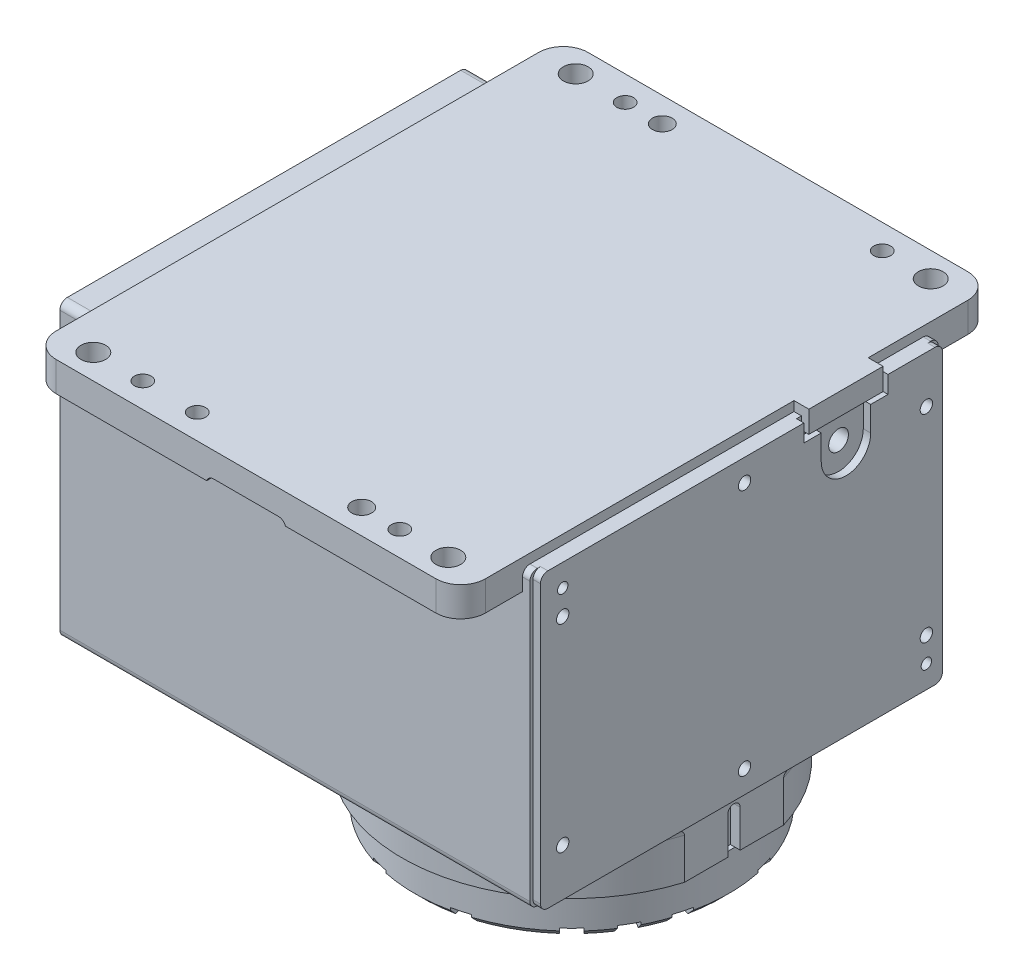
from build123d import *
from build123d.topology import SkipClean

# Parameters (mm, degrees)
SKETCH_1_W           = 186.99999787
SKETCH_1_H           = 165
EXTRUDE_1_DEPTH      = 118.00212
SKETCH_2_R           = 5
SKETCH_2_R_2         = 3.4
SKETCH_2_R_3         = 4
EXTRUDE_2_DEPTH      = 8.00224
CUT_EXTRUDE_1_DEPTH  = 25
CUT_EXTRUDE_START    = -25
CUT_EXTRUDE_2_DEPTH  = 25
EXTRUDE_START        = 3.99776
SKETCH_11_R          = 5
SKETCH_11_R_2        = 3.4
SKETCH_11_R_3        = 4
EXTRUDE_4_DEPTH      = 3.99776
FILLET_1_R           = 3
EXTRUDE_5_DEPTH      = 3
EXTRUDE_7_DEPTH      = 3
CUT_EXTRUDE_START_2  = -3
SKETCH_16_W          = 7.849893917
SKETCH_16_H          = 3.8429
SKETCH_16_W_2        = 32
CUT_EXTRUDE_3_DEPTH  = 3
CUT_EXTRUDE_4_DEPTH  = 3
FILLET_2_R           = 3
FILLET_3_R           = 3
FILLET_4_R           = 3
CUT_EXTRUDE_9_DEPTH  = 3
SKETCH_26_4_W        = 7
SKETCH_26_4_H        = 7
CUT_EXTRUDE_10_DEPTH = 6
SKETCH_27_W          = 20
SKETCH_27_H          = 5
CUT_EXTRUDE_11_DEPTH = 3
EXTRUDE_11_DEPTH     = 6
EXTRUDE_12_DEPTH     = 3
EXTRUDE_18_DEPTH     = 21.5
CUT_EXTRUDE_START_3  = -21.5
CUT_EXTRUDE_18_DEPTH = 21.5
FILLET_7_R           = 5
CUT_EXTRUDE_19_DEPTH = 4
SKETCH_37_R          = 63.5
EXTRUDE_19_DEPTH     = 18
CHAMFER_3_SIZE       = 3
CUT_EXTRUDE_20_DEPTH = 4
SKETCH_39_R          = 1.5
CUT_EXTRUDE_27_DEPTH = 6
SKETCH_30_R          = 4
CUT_EXTRUDE_29_DEPTH = 6
SKETCH_40_R          = 2.1
SKETCH_40_R_2        = 2.5
CUT_EXTRUDE_30_DEPTH = 8
SKETCH_41_R          = 2.5
CUT_EXTRUDE_31_DEPTH = 8
SKETCH_42_R          = 55
CUT_EXTRUDE_32_DEPTH = 10
FILLET_8_R           = 3


with BuildPart() as part:
    # ｽｹｯﾁ1 → ﾎﾞｽ - 押し出し1 (new body)
    with BuildSketch(Plane(origin=(0, 0, 0), x_dir=(1, 0, 0), z_dir=(0, 1, 0))):
        with Locations((93.499998935, 82.5)):
            Rectangle(SKETCH_1_W, SKETCH_1_H)
    extrude(amount=EXTRUDE_1_DEPTH)

    # ｽｹｯﾁ2 → ﾎﾞｽ - 押し出し2 (add)
    # profile 1 of 2: a face of its own
    with BuildSketch(Plane(origin=(0, 118.00212, 0), x_dir=(1, 0, 0), z_dir=(0, 1, 0))):
        with BuildLine():
            ThreePointArc((186.99999787, 180), (184.071065682, 187.071067812), (176.99999787, 190))
            Line((176.99999787, 190), (23.499999997, 190))
            ThreePointArc((23.499999997, 190), (16.428932185, 187.071067812), (13.499999997, 180))
            Line((13.499999997, 180), (13.499999997, 165))
            Line((13.499999997, 165), (186.99999787, 165))
            Line((186.99999787, 165), (186.99999787, 180))
        make_face()
        with Locations(Location((28.499999997, 180, 0), (0, 0, 270))):
            Circle(SKETCH_2_R, mode=Mode.SUBTRACT)
        with Locations(Location((48.499997861, 180, 0), (0, 0, 270))):
            Circle(SKETCH_2_R_2, mode=Mode.SUBTRACT)
        with Locations(Location((63.499999997, 180, 0), (0, 0, 270))):
            Circle(SKETCH_2_R_3, mode=Mode.SUBTRACT)
        with Locations(Location((152.402370037, 179.998516478, 0), (0, 0, 270))):
            Circle(SKETCH_2_R_2, mode=Mode.SUBTRACT)
        with Locations(Location((171.999995734, 180, 0), (0, 0, 270))):
            Circle(SKETCH_2_R, mode=Mode.SUBTRACT)
    # profile 2 of 2: a face of its own
    with BuildSketch(Plane(origin=(0, 118.00212, 0), x_dir=(1, 0, 0), z_dir=(0, 1, 0))):
        with BuildLine():
            ThreePointArc((13.499999997, -15), (16.428932185, -22.071067812), (23.499999997, -25))
            Line((23.499999997, -25), (176.99999787, -25))
            ThreePointArc((176.99999787, -25), (184.071065682, -22.071067812), (186.99999787, -15))
            Line((186.99999787, -15), (186.99999787, 0))
            Line((186.99999787, 0), (13.499999997, 0))
            Line((13.499999997, 0), (13.499999997, -15))
        make_face()
        with Locations(Location((28.499999997, -15, 0), (0, 0, 270))):
            Circle(SKETCH_2_R, mode=Mode.SUBTRACT)
        with Locations(Location((48.499997861, -15, 0), (0, 0, 270))):
            Circle(SKETCH_2_R_2, mode=Mode.SUBTRACT)
        with Locations(Location((70.499997861, -15, 0), (0, 0, 270))):
            Circle(SKETCH_2_R_2, mode=Mode.SUBTRACT)
        with BuildLine():
            ThreePointArc((136.999995734, -18.999999967), (134.17156861, -12.171572842), (140.999995734, -14.999999967))
            ThreePointArc((140.999995734, -14.999999967), (139.828422859, -17.828427092), (136.999995734, -18.999999967))
        make_face(mode=Mode.SUBTRACT)
        with Locations(Location((152.402545481, -15, 0), (0, 0, 270))):
            Circle(SKETCH_2_R_2, mode=Mode.SUBTRACT)
        with Locations(Location((171.999995734, -15, 0), (0, 0, 270))):
            Circle(SKETCH_2_R, mode=Mode.SUBTRACT)
    extrude(amount=-EXTRUDE_2_DEPTH)

    # ｽｹｯﾁ5 → ｶｯﾄ - 押し出し1 (cut)
    with BuildSketch(Plane(origin=(0, 0, -190), x_dir=(-1, 0, 0), z_dir=(0, 0, -1))):
        with BuildLine():
            Line((-100.249998933, 109.99988), (-100.249998933, 111.99988))
            Line((-100.249998933, 111.99988), (-113.344261724, 111.99988))
            ThreePointArc((-113.344261724, 111.99988), (-115.076312532, 111.449369743), (-116.172688849, 109.99988))
            Line((-116.172688849, 109.99988), (-100.249998933, 109.99988))
        make_face()
        with BuildLine():
            Line((-100.249998933, 109.99988), (-84.327309018, 109.99988))
            ThreePointArc((-84.327309018, 109.99988), (-85.423685335, 111.449369743), (-87.155736142, 111.99988))
            Line((-87.155736142, 111.99988), (-100.249998933, 111.99988))
            Line((-100.249998933, 111.99988), (-100.249998933, 109.99988))
        make_face()
    extrude(amount=-CUT_EXTRUDE_1_DEPTH, mode=Mode.SUBTRACT)

    # ｽｹｯﾁ8 → ｶｯﾄ - 押し出し2 (cut)
    with BuildSketch(Plane.XY.offset(25).offset(CUT_EXTRUDE_START)):
        with BuildLine():
            Line((100.249998933, 109.99988), (116.172688849, 109.99988))
            ThreePointArc((116.172688849, 109.99988), (115.076312532, 111.449369743), (113.344261725, 111.99988))
            Line((113.344261725, 111.99988), (100.249998933, 111.99988))
            Line((100.249998933, 111.99988), (100.249998933, 109.99988))
        make_face()
        with BuildLine():
            Line((100.249998933, 109.99988), (100.249998933, 111.99988))
            Line((100.249998933, 111.99988), (87.155736142, 111.99988))
            ThreePointArc((87.155736142, 111.99988), (85.423685335, 111.449369743), (84.327309018, 109.99988))
            Line((84.327309018, 109.99988), (100.249998933, 109.99988))
        make_face()
    extrude(amount=CUT_EXTRUDE_2_DEPTH, mode=Mode.SUBTRACT)

    # ｽｹｯﾁ11 → ﾎﾞｽ - 押し出し4 (add)
    with SkipClean():  # the faces are left unmerged after this step: merging them gives an invalid solid
        with BuildSketch(Plane(origin=(0, 118.00212, 0), x_dir=(1, 0, 0), z_dir=(0, 1, 0)).offset(EXTRUDE_START)):
            with BuildLine():
                Line((13.499999997, 165), (13.499999997, 0))
                Line((13.499999997, 0), (13.499999997, -15))
                ThreePointArc((13.499999997, -15), (16.428932185, -22.071067812), (23.499999997, -25))
                Line((23.499999997, -25), (176.99999787, -25))
                ThreePointArc((176.99999787, -25), (184.071065682, -22.071067812), (186.99999787, -15))
                Line((186.99999787, -15), (186.99999787, 180))
                ThreePointArc((186.99999787, 180), (184.071065682, 187.071067812), (176.99999787, 190))
                Line((176.99999787, 190), (23.499999997, 190))
                ThreePointArc((23.499999997, 190), (16.428932185, 187.071067812), (13.499999997, 180))
                Line((13.499999997, 180), (13.499999997, 165))
            make_face()
            with Locations(Location((171.999995734, -15, 0), (0, 0, 270))):
                Circle(SKETCH_11_R, mode=Mode.SUBTRACT)
            with Locations(Location((152.402545481, -15, 0), (0, 0, 270))):
                Circle(SKETCH_11_R_2, mode=Mode.SUBTRACT)
            with Locations(Location((136.999995734, -14.999999967, 0), (0, 0, 270))):
                Circle(SKETCH_11_R_3, mode=Mode.SUBTRACT)
            with Locations(Location((28.499999997, -15, 0), (0, 0, 270))):
                Circle(SKETCH_11_R, mode=Mode.SUBTRACT)
            with Locations(Location((48.499997861, -15, 0), (0, 0, 270))):
                Circle(SKETCH_11_R_2, mode=Mode.SUBTRACT)
            with Locations(Location((70.499997861, -15, 0), (0, 0, 270))):
                Circle(SKETCH_11_R_2, mode=Mode.SUBTRACT)
            with Locations(Location((171.999995734, 180, 0), (0, 0, 270))):
                Circle(SKETCH_11_R, mode=Mode.SUBTRACT)
            with Locations(Location((152.402370037, 179.998516478, 0), (0, 0, 270))):
                Circle(SKETCH_11_R_2, mode=Mode.SUBTRACT)
            with Locations(Location((63.499999997, 180, 0), (0, 0, 270))):
                Circle(SKETCH_11_R_3, mode=Mode.SUBTRACT)
            with Locations(Location((48.499997861, 180, 0), (0, 0, 270))):
                Circle(SKETCH_11_R_2, mode=Mode.SUBTRACT)
            with Locations(Location((28.499999997, 180, 0), (0, 0, 270))):
                Circle(SKETCH_11_R, mode=Mode.SUBTRACT)
        extrude(amount=-EXTRUDE_4_DEPTH)

    # ﾌｨﾚｯﾄ1
    # the kernel refuses this fillet: 3 mm, written as the material it adds along each edge
    with BuildSketch(Plane(origin=(13.499999997, 118.00212, -165), x_dir=(-1, 0, 0), z_dir=(0, 0, 1))) as fillet_1_piece_1:
        with BuildLine():
            CenterArc((FILLET_1_R, -FILLET_1_R), FILLET_1_R, 90, 90)
            Line((0, -FILLET_1_R), (0, 0))
            Line((0, 0), (FILLET_1_R, 0))
        make_face()
    extrude(amount=165)

    # ｽｹｯﾁ12 → ﾎﾞｽ - 押し出し5 (add)
    with BuildSketch(Plane(origin=(186.99999787, 0, 0), x_dir=(0, 0, -1), z_dir=(1, 0, 0))):
        Polygon((0, 0), (165, 0), (165, 109.99988), (165, 121.99988), (0, 121.99988), (0, 109.99988), align=None)
    extrude(amount=EXTRUDE_5_DEPTH)

    # ｽｹｯﾁ14 → ﾎﾞｽ - 押し出し7 (add)
    with BuildSketch(Plane(origin=(189.99999787, 0, 0), x_dir=(0, 0, -1), z_dir=(1, 0, 0))):
        with BuildLine():
            Line((160.75, 0), (4.25, 0))
            ThreePointArc((4.25, 0), (2.128679656, 0.878679656), (1.25, 3))
            Line((1.25, 3), (1.25, 118.99988))
            ThreePointArc((1.25, 118.99988), (2.128679656, 121.121200344), (4.25, 121.99988))
            Line((4.25, 121.99988), (160.75, 121.99988))
            ThreePointArc((160.75, 121.99988), (162.871320344, 121.121200344), (163.75, 118.99988))
            Line((163.75, 118.99988), (163.75, 3))
            ThreePointArc((163.75, 3), (162.871320344, 0.878679656), (160.75, 0))
        make_face()
    extrude(amount=EXTRUDE_7_DEPTH)

    # ｽｹｯﾁ16 → ｶｯﾄ - 押し出し3 (cut)
    with BuildSketch(Plane(origin=(192.99999787, 0, 0), x_dir=(0, 0, -1), z_dir=(1, 0, 0)).offset(CUT_EXTRUDE_START_2)):
        with BuildLine():
            Line((109.900106083, 118.15698), (109.900106083, 121.99988))
            Line((109.900106083, 121.99988), (4.25, 121.99988))
            ThreePointArc((4.25, 121.99988), (2.128679656, 121.121200344), (1.25, 118.99988))
            Line((1.25, 118.99988), (1.25, 118.15698))
            Line((1.25, 118.15698), (109.900106083, 118.15698))
        make_face()
        with Locations((113.825053042, 120.07843)):
            Rectangle(SKETCH_16_W, SKETCH_16_H)
        with Locations((133.75, 120.07843)):
            Rectangle(SKETCH_16_W_2, SKETCH_16_H)
        with BuildLine():
            Line((160.75, 121.99988), (149.75, 121.99988))
            Line((149.75, 121.99988), (149.75, 118.15698))
            Line((149.75, 118.15698), (163.75, 118.15698))
            Line((163.75, 118.15698), (163.75, 118.99988))
            ThreePointArc((163.75, 118.99988), (162.871320344, 121.121200344), (160.75, 121.99988))
        make_face()
        with BuildLine():
            Line((163.75, 121.99988), (160.75, 121.99988))
            ThreePointArc((160.75, 121.99988), (162.871320344, 121.121200344), (163.75, 118.99988))
            Line((163.75, 118.99988), (163.75, 121.99988))
        make_face()
        with BuildLine():
            ThreePointArc((1.25, 118.99988), (2.128679656, 121.121200344), (4.25, 121.99988))
            Line((4.25, 121.99988), (1.25, 121.99988))
            Line((1.25, 121.99988), (1.25, 118.99988))
        make_face()
    extrude(amount=CUT_EXTRUDE_3_DEPTH, mode=Mode.SUBTRACT)

    # ｽｹｯﾁ17 → ｶｯﾄ - 押し出し4 (cut)
    with BuildSketch(Plane(origin=(189.99999787, 0, 0), x_dir=(0, 0, -1), z_dir=(1, 0, 0))):
        Polygon((0, 118.15698), (1.25, 118.15698), (163.75, 118.15698), (165, 118.15698), (165, 121.99988), (0, 121.99988), align=None)
    extrude(amount=-CUT_EXTRUDE_4_DEPTH, mode=Mode.SUBTRACT)

    # ﾌｨﾚｯﾄ2
    fillet_2_edges = [part.edges().sort_by_distance(p)[0] for p in [
        (191.49999787, 118.15698, -1.25),
        (191.49999787, 118.15698, -163.75),
    ]]
    fillet(fillet_2_edges, radius=FILLET_2_R)

    # ﾌｨﾚｯﾄ3
    fillet_3_edges = [part.edges().sort_by_distance(p)[0] for p in [
        (188.49999787, 118.15698, -165),
        (188.49999787, 118.15698, 0),
    ]]
    fillet(fillet_3_edges, radius=FILLET_3_R)

    # ﾌｨﾚｯﾄ4
    fillet_4_edges = [part.edges().sort_by_distance(p)[0] for p in [
        (94.999998935, 0, -165),
        (94.999998935, 0, 0),
    ]]
    fillet(fillet_4_edges, radius=FILLET_4_R)

    # ｽｹｯﾁ26 → ｶｯﾄ - 押し出し9 (cut)
    with BuildSketch(Plane(origin=(192.99999787, 0, 0), x_dir=(0, 0, -1), z_dir=(1, 0, 0))):
        with BuildLine():
            Line((134.75, 111.15698), (134.75, 118.15698))
            Line((134.75, 118.15698), (124.75, 118.15698))
            Line((124.75, 118.15698), (124.75, 101.15698))
            Line((124.75, 101.15698), (124.75, 91.15698))
            ThreePointArc((124.75, 91.15698), (131.821067812, 94.085912188), (134.75, 101.15698))
            Line((134.75, 101.15698), (134.75, 111.15698))
        make_face()
        with BuildLine():
            Line((124.75, 101.15698), (124.75, 118.15698))
            Line((124.75, 118.15698), (114.75, 118.15698))
            Line((114.75, 118.15698), (114.75, 111.15698))
            Line((114.75, 111.15698), (114.75, 101.15698))
            ThreePointArc((114.75, 101.15698), (117.678932188, 94.085912188), (124.75, 91.15698))
            Line((124.75, 91.15698), (124.75, 101.15698))
        make_face()
    extrude(amount=-CUT_EXTRUDE_9_DEPTH, mode=Mode.SUBTRACT)

    # ｽｹｯﾁ26<4> → ｶｯﾄ - 押し出し10 (cut)
    with BuildSketch(Plane(origin=(192.99999787, 0, 0), x_dir=(0, 0, -1), z_dir=(1, 0, 0))):
        with Locations((111.25, 114.65698)):
            Rectangle(SKETCH_26_4_W, SKETCH_26_4_H)
        with Locations((138.25, 114.65698)):
            Rectangle(SKETCH_26_4_W, SKETCH_26_4_H)
    extrude(amount=-CUT_EXTRUDE_10_DEPTH, mode=Mode.SUBTRACT)

    # ｽｹｯﾁ27 → ｶｯﾄ - 押し出し11 (cut)
    with BuildSketch(Plane(origin=(189.99999787, 0, 0), x_dir=(0, 0, -1), z_dir=(1, 0, 0))):
        with Locations((124.75, 115.65698)):
            Rectangle(SKETCH_27_W, SKETCH_27_H)
    extrude(amount=-CUT_EXTRUDE_11_DEPTH, mode=Mode.SUBTRACT)

    # ｽｹｯﾁ28 → ﾎﾞｽ - 押し出し11 (add)
    with BuildSketch(Plane(origin=(186.99999787, 0, 0), x_dir=(0, 0, -1), z_dir=(1, 0, 0))):
        Polygon((134.75, 113.15698), (139.75, 113.15698), (139.75, 121.99988), (109.75, 121.99988), (109.75, 113.15698), (114.75, 113.15698), align=None)
    extrude(amount=EXTRUDE_11_DEPTH)

    # ｽｹｯﾁ29 → ﾎﾞｽ - 押し出し12 (add)
    with BuildSketch(Plane(origin=(186.99999787, 0, 0), x_dir=(0, 0, -1), z_dir=(1, 0, 0))):
        Polygon((141.75, 118.15698), (139.75, 118.15698), (139.75, 113.15698), (134.75, 113.15698), (134.75, 111.15698), (141.75, 111.15698), align=None)
        Polygon((107.75, 111.15698), (107.75, 118.15698), (109.75, 118.15698), (109.75, 113.15698), (114.75, 113.15698), (114.75, 111.15698), align=None)
    extrude(amount=EXTRUDE_12_DEPTH)

    # ｽｹｯﾁ32 → ﾎﾞｽ - 押し出し18 (add)
    with BuildSketch(Plane.XZ):
        with BuildLine():
            ThreePointArc((55.82462787, -82.5), (124.41231287, -151.087685), (192.99999787, -82.5))
            Line((192.99999787, -82.5), (55.82462787, -82.5))
        make_face()
        with BuildLine():
            Line((55.82462787, -82.5), (192.99999787, -82.5))
            ThreePointArc((192.99999787, -82.5), (124.41231287, -13.912315), (55.82462787, -82.5))
        make_face()
    extrude(amount=EXTRUDE_18_DEPTH)

    # ｽｹｯﾁ35 → ｶｯﾄ - 押し出し18 (cut)
    with BuildSketch(Plane.XZ.offset(21.5).offset(CUT_EXTRUDE_START_3)):
        with BuildLine():
            Line((189.99999787, -82.5), (192.99999787, -82.5))
            ThreePointArc((192.99999787, -82.5), (192.245851818, -72.356946835), (189.99999787, -62.436946643))
            Line((189.99999787, -62.436946643), (189.99999787, -82.5))
        make_face()
        with BuildLine():
            ThreePointArc((189.99999787, -102.563053357), (192.245851818, -92.643053165), (192.99999787, -82.5))
            Line((192.99999787, -82.5), (189.99999787, -82.5))
            Line((189.99999787, -82.5), (189.99999787, -102.563053357))
        make_face()
    extrude(amount=CUT_EXTRUDE_18_DEPTH, mode=Mode.SUBTRACT)

    # ﾌｨﾚｯﾄ7
    fillet_7_edges = [part.edges().sort_by_distance(p)[0] for p in [
        (55.82462787, 0, -82.5),
    ]]
    fillet(fillet_7_edges, radius=FILLET_7_R)

    # ｽｹｯﾁ36 → ｶｯﾄ - 押し出し19 (cut)
    with BuildSketch(Plane(origin=(189.99999787, 0, 0), x_dir=(0, 0, -1), z_dir=(1, 0, 0))):
        with BuildLine():
            Line((80, -6.5), (80, -21.5))
            Line((80, -21.5), (85, -21.5))
            Line((85, -21.5), (85, -6.5))
            ThreePointArc((85, -6.5), (82.5, -4), (80, -6.5))
        make_face()
    extrude(amount=-CUT_EXTRUDE_19_DEPTH, mode=Mode.SUBTRACT)

    # ｽｹｯﾁ37 → ﾎﾞｽ - 押し出し19 (add)
    with BuildSketch(Plane(origin=(0, -21.5, 0), x_dir=(-1, 0, 0), z_dir=(0, -1, 0))):
        with Locations(Location((-124.41231287, 82.5, 0), (0, 0, 182.256322492))):
            Circle(SKETCH_37_R)
    extrude(amount=EXTRUDE_19_DEPTH)

    # 面取り3
    chamfer_3_edges = [part.edges().sort_by_distance(p)[0] for p in [
        (60.961544553, -39.5, -85),
    ]]
    chamfer(chamfer_3_edges, length=CHAMFER_3_SIZE)

    # ｽｹｯﾁ38 → ｶｯﾄ - 押し出し20 (cut)
    with BuildSketch(Plane.XZ.offset(39.5)):
        Polygon((62.170156243, -69.445731028), (63.981889559, -62.684250244), (71.226333256, -64.625393082), (69.41459994, -71.386873866), align=None)
        Polygon((63.981889559, -102.315749756), (62.170156243, -95.554268972), (69.41459994, -93.613126134), (71.226333256, -100.374606918), align=None)
        Polygon((77.036158531, -40.073593129), (81.985905999, -35.123845661), (87.289206858, -40.427146519), (82.339459389, -45.376893988), align=None)
        Polygon((104.596563114, -22.069576689), (111.358043898, -20.257843373), (113.299186736, -27.50228707), (106.537705952, -29.314020386), align=None)
        Polygon((137.466581842, -20.257843373), (144.228062626, -22.069576689), (142.286919788, -29.314020386), (135.525439004, -27.50228707), align=None)
        Polygon((166.838719741, -35.123845661), (171.788467209, -40.073593129), (166.485166351, -45.376893988), (161.535418882, -40.427146519), align=None)
        Polygon((184.842736181, -62.684250244), (186.654469497, -69.445731028), (179.4100258, -71.386873866), (177.598292484, -64.625393082), align=None)
        Polygon((186.654469497, -95.554268972), (184.842736181, -102.315749756), (177.598292484, -100.374606918), (179.4100258, -93.613126134), align=None)
        Polygon((171.788467209, -124.926406871), (166.838719741, -129.876154339), (161.535418882, -124.572853481), (166.485166351, -119.623106012), align=None)
        Polygon((144.228062626, -142.930423311), (137.466581842, -144.742156627), (135.525439004, -137.49771293), (142.286919788, -135.685979614), align=None)
        Polygon((111.358043898, -144.742156627), (104.596563114, -142.930423311), (106.537705952, -135.685979614), (113.299186736, -137.49771293), align=None)
        Polygon((81.985905999, -129.876154339), (77.036158531, -124.926406871), (82.339459389, -119.623106012), (87.289206858, -124.572853481), align=None)
        Polygon((71.16969973, -117.281088913), (67.66969973, -111.218911087), (73.731877556, -107.718911087), (77.231877556, -113.781088913), align=None)
        Polygon((177.65492601, -47.718911087), (181.15492601, -53.781088913), (175.092748184, -57.281088913), (171.592748184, -51.218911087), align=None)
    extrude(amount=-CUT_EXTRUDE_20_DEPTH, mode=Mode.SUBTRACT)

    # ｽｹｯﾁ39 → ｶｯﾄ - 押し出し27 (cut)
    with BuildSketch(Plane.XZ.offset(35.5)):
        with Locations(Location((182.126380991, -97.964437945, 0), (0, 0, 270))):
            Circle(SKETCH_39_R)
        with Locations(Location((166.661943046, -124.749630176, 0), (0, 0, 270))):
            Circle(SKETCH_39_R)
        with Locations(Location((139.876750815, -140.214068121, 0), (0, 0, 270))):
            Circle(SKETCH_39_R)
        with Locations(Location((108.947874925, -140.214068121, 0), (0, 0, 270))):
            Circle(SKETCH_39_R)
        with Locations(Location((82.162682694, -124.749630176, 0), (0, 0, 270))):
            Circle(SKETCH_39_R)
        with Locations(Location((66.698244749, -97.964437945, 0), (0, 0, 270))):
            Circle(SKETCH_39_R)
        with Locations(Location((66.698244749, -67.035562055, 0), (0, 0, 270))):
            Circle(SKETCH_39_R)
        with Locations(Location((82.162682694, -40.250369824, 0), (0, 0, 270))):
            Circle(SKETCH_39_R)
        with Locations(Location((108.947874925, -24.785931879, 0), (0, 0, 270))):
            Circle(SKETCH_39_R)
        with Locations(Location((139.876750815, -24.785931879, 0), (0, 0, 270))):
            Circle(SKETCH_39_R)
        with Locations(Location((166.661943046, -40.250369824, 0), (0, 0, 270))):
            Circle(SKETCH_39_R)
        with Locations(Location((182.126380991, -67.035562055, 0), (0, 0, 270))):
            Circle(SKETCH_39_R)
        with Locations(Location((176.373837097, -52.5, 0), (0, 0, 270))):
            Circle(SKETCH_39_R)
        with Locations(Location((72.450788643, -112.5, 0), (0, 0, 270))):
            Circle(SKETCH_39_R)
    extrude(amount=-CUT_EXTRUDE_27_DEPTH, mode=Mode.SUBTRACT)

    # ｽｹｯﾁ30 → ｶｯﾄ - 押し出し29 (cut)
    with BuildSketch(Plane(origin=(189.99999787, 0, 0), x_dir=(0, 0, -1), z_dir=(1, 0, 0))):
        with Locations((124.75, 102.15698)):
            Circle(SKETCH_30_R)
    extrude(amount=-CUT_EXTRUDE_29_DEPTH, mode=Mode.SUBTRACT)

    # ｽｹｯﾁ40 → ｶｯﾄ - 押し出し30 (cut)
    with BuildSketch(Plane(origin=(192.99999787, 0, 0), x_dir=(0, 0, -1), z_dir=(1, 0, 0))):
        with Locations((10.25, 109.15698)):
            Circle(SKETCH_40_R)
        with Locations((157.245295268, 9.156979998)):
            Circle(SKETCH_40_R)
        with Locations((157.245295268, 99.15698)):
            Circle(SKETCH_40_R_2)
        with Locations((83.745295268, 109.15698)):
            Circle(SKETCH_40_R_2)
        with Locations((10.25, 99.15698)):
            Circle(SKETCH_40_R_2)
        with Locations((10.25, 19.156979998)):
            Circle(SKETCH_40_R_2)
        with Locations((83.745295268, 9.156979998)):
            Circle(SKETCH_40_R_2)
        with Locations((157.245295268, 19.156979998)):
            Circle(SKETCH_40_R_2)
    extrude(amount=-CUT_EXTRUDE_30_DEPTH, mode=Mode.SUBTRACT)

    # ｽｹｯﾁ41 → ｶｯﾄ - 押し出し31 (cut)
    with BuildSketch(Plane.ZY):
        with Locations((-82.5, 109.00212)):
            Circle(SKETCH_41_R)
        with Locations((-156, 99.00212)):
            Circle(SKETCH_41_R)
        with Locations(Location((-156, 22, 0), (0, 0, 180))):
            Circle(SKETCH_41_R)
        with Locations(Location((-82.5, 12, 0), (0, 0, 180))):
            Circle(SKETCH_41_R)
        with Locations(Location((-9, 99.00212, 0), (0, 0, 180))):
            Circle(SKETCH_41_R)
        with Locations((-9, 22)):
            Circle(SKETCH_41_R)
    extrude(amount=-CUT_EXTRUDE_31_DEPTH, mode=Mode.SUBTRACT)

    # ｽｹｯﾁ42 → ｶｯﾄ - 押し出し32 (cut)
    with BuildSketch(Plane.XZ.offset(39.5)):
        with Locations(Location((124.41231287, -82.5, 0), (0, 0, 270))):
            Circle(SKETCH_42_R)
    extrude(amount=-CUT_EXTRUDE_32_DEPTH, mode=Mode.SUBTRACT)

    # ﾌｨﾚｯﾄ8
    # the kernel refuses this fillet: 3 mm, written as the material it takes off along each edge
    with BuildSketch(Plane(origin=(10.499999997, 118.00212, 0), x_dir=(0, -1, 0), z_dir=(-1, 0, 0))) as fillet_8_piece_1:
        with BuildLine():
            CenterArc((FILLET_8_R, -FILLET_8_R), FILLET_8_R, 90, 90)
            Line((0, -FILLET_8_R), (0, 0))
            Line((0, 0), (FILLET_8_R, 0))
        make_face()
    extrude(amount=17.999999997, mode=Mode.SUBTRACT)
    with BuildSketch(Plane(origin=(10.499999997, 121.00212, 0), x_dir=(0, -1, 0), z_dir=(-1, 0, 0))) as fillet_8_piece_2_section:
        with BuildLine():
            CenterArc((3 + FILLET_8_R, -FILLET_8_R), FILLET_8_R, 90, 90)
            Line((3, -FILLET_8_R), (3, 0))
            Line((3, 0), (3 + FILLET_8_R, 0))
        make_face()
    fillet_8_piece_2 = revolve(axis=Axis((10.499999997, 121.00212, 0), (0, 0, 1)), revolution_arc=233.296989237, mode=Mode.PRIVATE)
    fillet_8_piece_2 = split(fillet_8_piece_2, bisect_by=Plane(origin=(13.499999997, 117.342794264, -0.501900634), z_dir=(-1, 0, 0)), keep=Keep.TOP, mode=Mode.PRIVATE)
    add(fillet_8_piece_2, mode=Mode.SUBTRACT)
    with BuildSketch(Plane(origin=(10.499999997, 121.00212, -165), x_dir=(0, -1, 0), z_dir=(-1, 0, 0))) as fillet_8_piece_3_section:
        with BuildLine():
            CenterArc((3 + FILLET_8_R, FILLET_8_R), FILLET_8_R, 180, 90)
            Line((3, FILLET_8_R), (3, 0))
            Line((3, 0), (3 + FILLET_8_R, 0))
        make_face()
    fillet_8_piece_3 = revolve(axis=Axis((10.499999997, 121.00212, -165), (0, 0, 1)), revolution_arc=233.296989237, mode=Mode.PRIVATE)
    fillet_8_piece_3 = split(fillet_8_piece_3, bisect_by=Plane(origin=(13.499999997, 117.342794264, -164.498099366), z_dir=(-1, 0, 0)), keep=Keep.TOP, mode=Mode.PRIVATE)
    add(fillet_8_piece_3, mode=Mode.SUBTRACT)
    with BuildSketch(Plane(origin=(-7.5, 118.00212, -165), x_dir=(0, 0, 1), z_dir=(1, 0, 0))) as fillet_8_piece_4:
        with BuildLine():
            CenterArc((FILLET_8_R, FILLET_8_R), FILLET_8_R, 180, 90)
            Line((0, FILLET_8_R), (0, 0))
            Line((0, 0), (FILLET_8_R, 0))
        make_face()
    extrude(amount=17.999999997, mode=Mode.SUBTRACT)


solid = part.part
